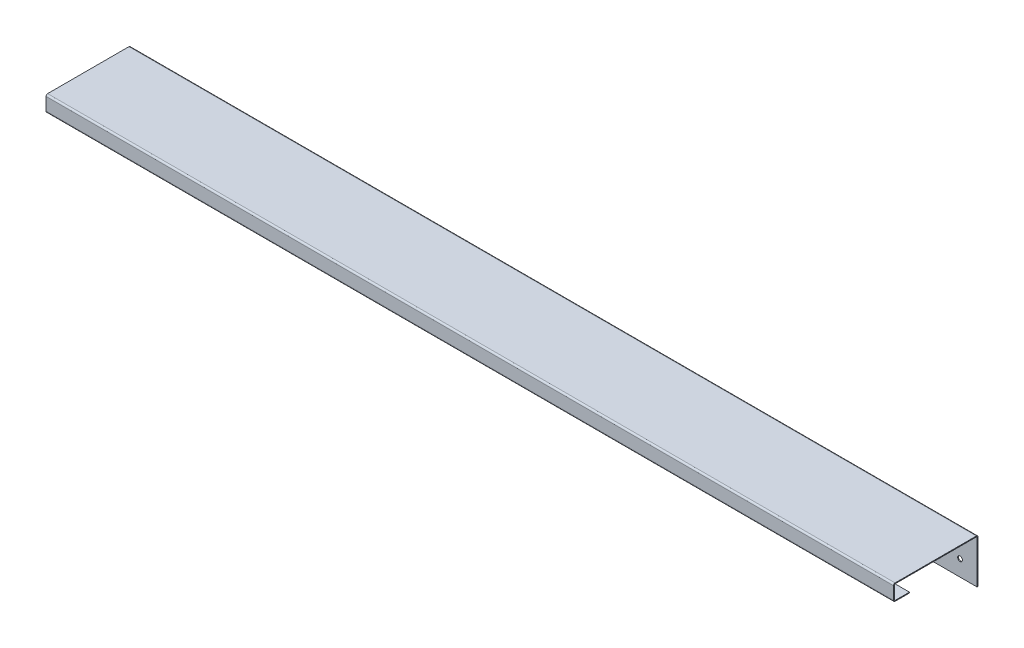
from build123d import *

# Parameters (mm, degrees)
BASE_FLANGE1_DEPTH = 1063
SKETCH2_R          = 3
CUT_EXTRUDE1_DEPTH = 10


# Sheet-metal steps are written as plain solids
with BuildPart() as part:
    # Sketch1 → Base-Flange1 (new body)
    with BuildSketch(Plane(origin=(0, 0, 0), x_dir=(0, 0, -1), z_dir=(1, 0, 0))):
        with BuildLine():
            Line((104, -27.232585832), (104, 26.767414168))
            ThreePointArc((104, 26.767414168), (103.707106781, 27.474520949), (103, 27.767414168))
            Line((103, 27.767414168), (1, 27.767414168))
            ThreePointArc((1, 27.767414168), (0.292893219, 27.474520949), (0, 26.767414168))
            Line((0, 26.767414168), (0, 10.767414168))
            ThreePointArc((0, 10.767414168), (0.292893219, 10.060307386), (1, 9.767414168))
            Line((1, 9.767414168), (19, 9.767414168))
            Line((19, 9.767414168), (19, 8.767414168))
            Line((19, 8.767414168), (1, 8.767414168))
            ThreePointArc((1, 8.767414168), (-0.414213562, 9.353200605), (-1, 10.767414168))
            Line((-1, 10.767414168), (-1, 26.767414168))
            ThreePointArc((-1, 26.767414168), (-0.414213562, 28.18162773), (1, 28.767414168))
            Line((1, 28.767414168), (103, 28.767414168))
            ThreePointArc((103, 28.767414168), (104.414213562, 28.18162773), (105, 26.767414168))
            Line((105, 26.767414168), (105, -27.232585832))
            Line((105, -27.232585832), (104, -27.232585832))
        make_face()
    extrude(amount=BASE_FLANGE1_DEPTH)

    # Sketch2 → Cut-Extrude1 (cut)
    with BuildSketch(Plane.XY.offset(-104)):
        with Locations((21.5, -7.232585832)):
            Circle(SKETCH2_R)
        with Locations((1041.5, -7.232585832)):
            Circle(SKETCH2_R)
    extrude(amount=-CUT_EXTRUDE1_DEPTH, mode=Mode.SUBTRACT)


solid = part.part
